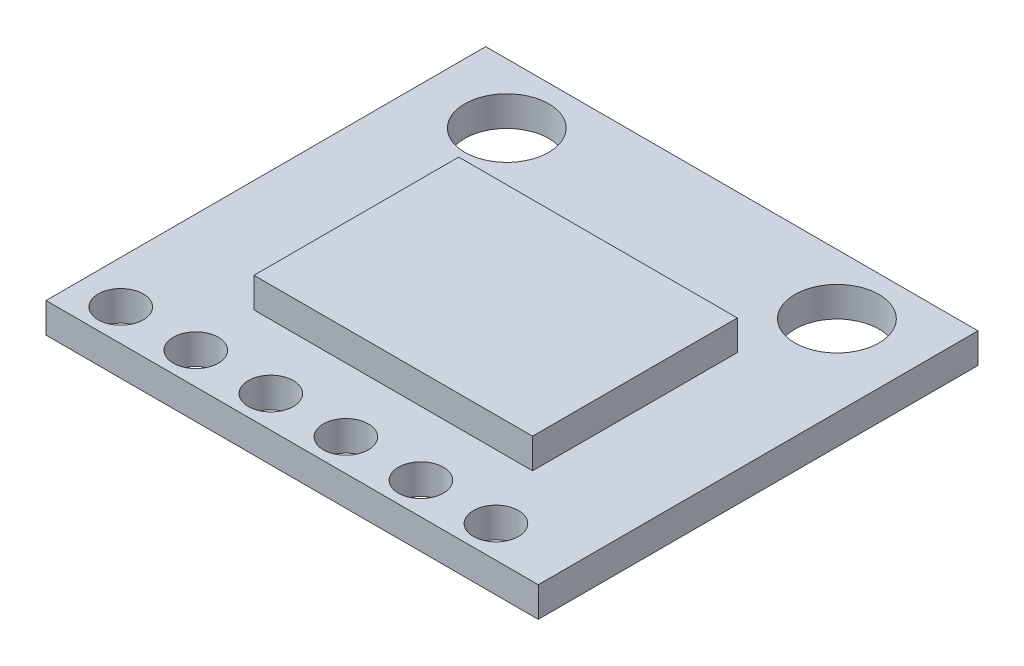
from build123d import *

# Parameters (mm, degrees)
SKETCH1_W           = 16.4
SKETCH1_H           = 14.65
BOSS_EXTRUDE1_DEPTH = 1
SKETCH2_R           = 0.75
SKETCH2_R_2         = 1.4
CUT_EXTRUDE1_DEPTH  = 23.013234656
SKETCH3_W           = 9.281589498
SKETCH3_H           = 6.821714685
BOSS_EXTRUDE2_DEPTH = 1


with BuildPart() as part:
    # Sketch1 → Boss-Extrude1 (new body)
    with BuildSketch(Plane(origin=(0, 0, 0), x_dir=(1, 0, 0), z_dir=(0, 1, 0))):
        with Locations((8.2, 7.325)):
            Rectangle(SKETCH1_W, SKETCH1_H)
    extrude(amount=BOSS_EXTRUDE1_DEPTH)

    # Sketch2 → Cut-Extrude1 (cut, through all)
    with BuildSketch(Plane(origin=(0, 1, 0), x_dir=(1, 0, 0), z_dir=(0, 1, 0))):
        with Locations((1.429004383, 1.061195066)):
            Circle(SKETCH2_R)
        with Locations((3.929004383, 1.061195066)):
            Circle(SKETCH2_R)
        with Locations((6.429004383, 1.061195066)):
            Circle(SKETCH2_R)
        with Locations((8.929004383, 1.061195066)):
            Circle(SKETCH2_R)
        with Locations((11.429004383, 1.061195066)):
            Circle(SKETCH2_R)
        with Locations((13.929004383, 1.061195066)):
            Circle(SKETCH2_R)
        with Locations((2.7, 12.65)):
            Circle(SKETCH2_R_2)
        with Locations((13.7, 12.65)):
            Circle(SKETCH2_R_2)
    extrude(amount=-CUT_EXTRUDE1_DEPTH, mode=Mode.SUBTRACT)

    # Sketch3 → Boss-Extrude2 (add)
    with BuildSketch(Plane(origin=(0, 1, 0), x_dir=(1, 0, 0), z_dir=(0, 1, 0))):
        with Locations((8.377516739, 6.602253277)):
            Rectangle(SKETCH3_W, SKETCH3_H)
    extrude(amount=BOSS_EXTRUDE2_DEPTH)


solid = part.part
